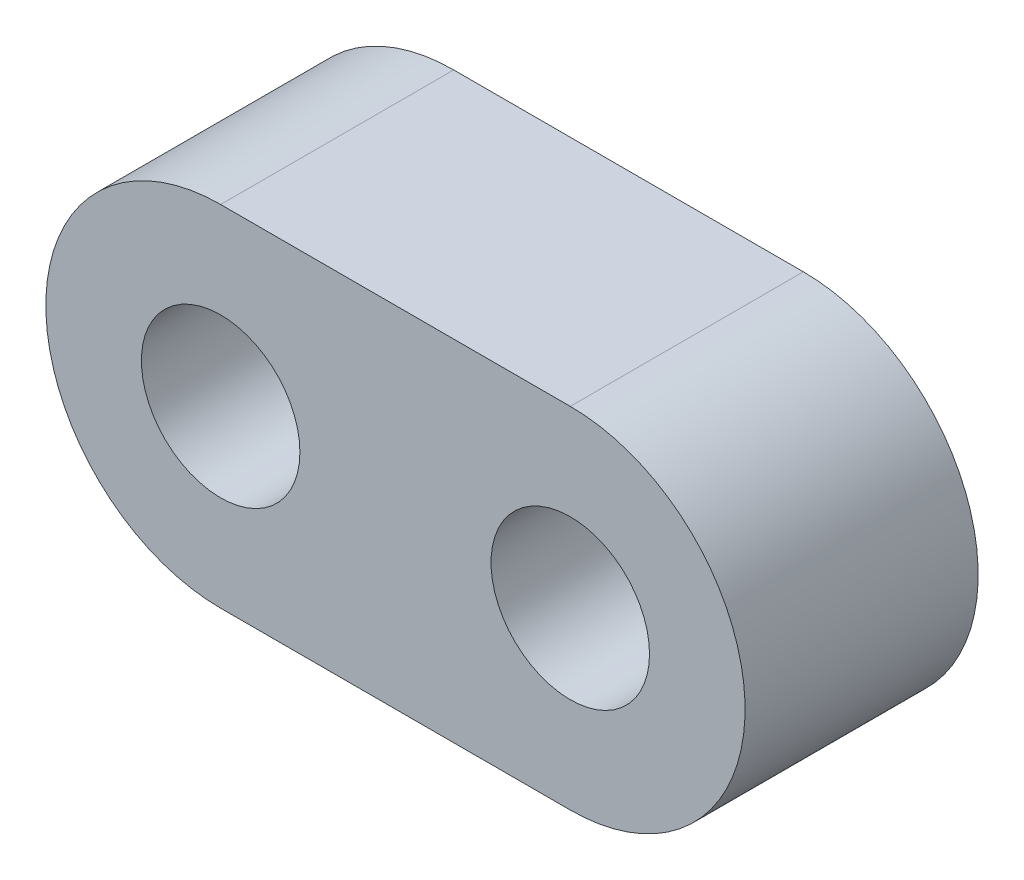
from build123d import *

# Parameters (mm, degrees)
SKETCH1_R           = 2.159
BOSS_EXTRUDE1_DEPTH = 6.35


with BuildPart() as part:
    # Sketch1 → Boss-Extrude1 (new body)
    with BuildSketch(Plane.XY):
        with BuildLine():
            Line((0, 4.7625), (9.525, 4.7625))
            ThreePointArc((9.525, 4.7625), (14.2875, 0), (9.525, -4.7625))
            Line((9.525, -4.7625), (0, -4.7625))
            ThreePointArc((0, -4.7625), (-4.7625, 0), (0, 4.7625))
        make_face()
        with Locations((9.525, 0)):
            Circle(SKETCH1_R, mode=Mode.SUBTRACT)
        Circle(SKETCH1_R, mode=Mode.SUBTRACT)
    extrude(amount=BOSS_EXTRUDE1_DEPTH)


solid = part.part
